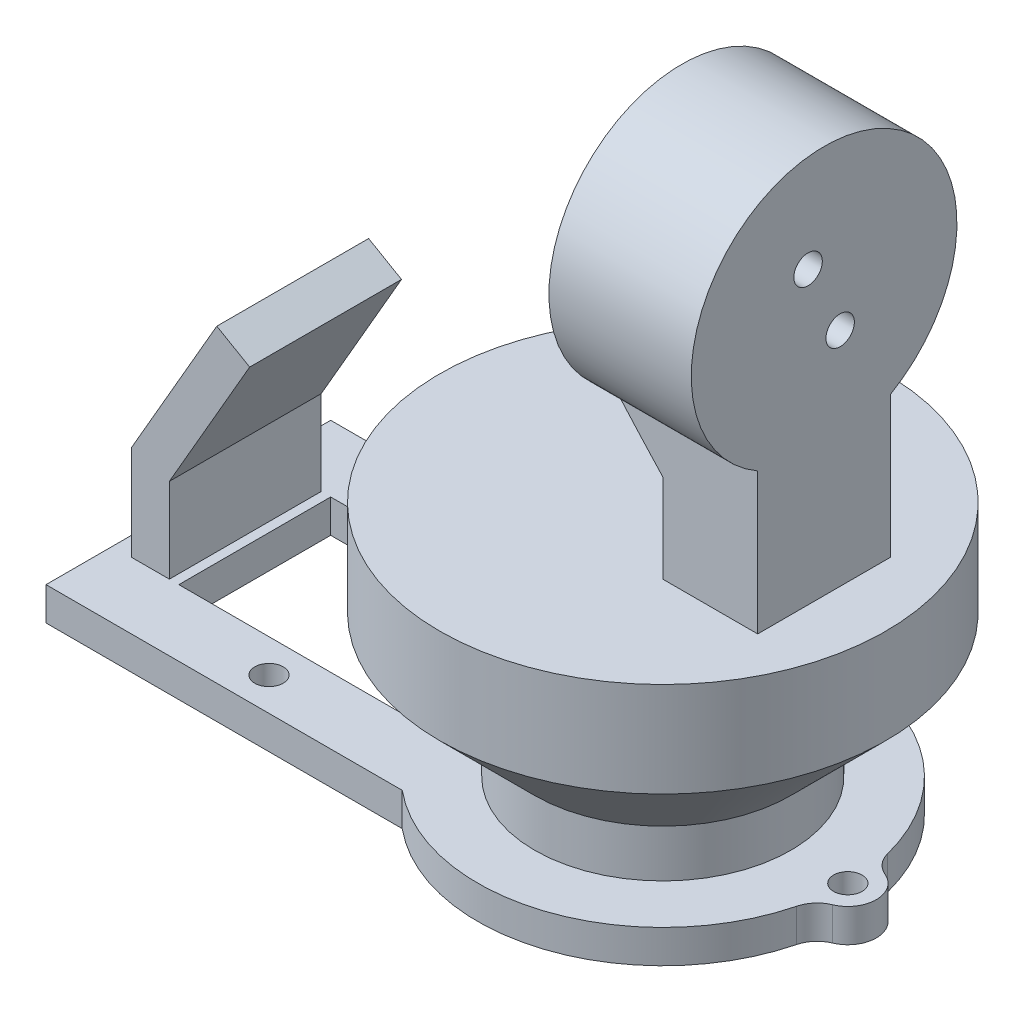
from build123d import *

# Parameters (mm, degrees)
SKETCH1_R           = 1.5
BOSS_EXTRUDE1_DEPTH = 3.5
BOSS_EXTRUDE2_DEPTH = 16
SKETCH4_R           = 13.5
BOSS_EXTRUDE3_DEPTH = 15
SKETCH5_R           = 23.5
BOSS_EXTRUDE4_DEPTH = 10
SKETCH6_W           = 10
SKETCH6_H           = 14
BOSS_EXTRUDE5_DEPTH = 20
SKETCH7_R           = 14
BOSS_EXTRUDE6_DEPTH = 15
CHAMFER1_SIZE       = 10
CUT_EXTRUDE4_REACH  = 91.925
SKETCH10_R          = 1.5
CHAMFER2_SIZE       = 5


with BuildPart() as part:
    # Sketch1 → Boss-Extrude1 (new body)
    with BuildSketch(Plane(origin=(0, 0, 0), x_dir=(1, 0, 0), z_dir=(0, 1, 0))):
        with BuildLine():
            Line((-50, -15), (-12.459935794, -15))
            ThreePointArc((-12.459935794, -15), (6.031468042, -18.543769661), (18.9, -4.8))
            ThreePointArc((18.9, -4.8), (19.537223284, -3.577601927), (20.653846154, -2.769230769))
            ThreePointArc((20.653846154, -2.769230769), (22.5, 0), (20.653846154, 2.769230769))
            ThreePointArc((20.653846154, 2.769230769), (19.537223284, 3.577601927), (18.9, 4.8))
            ThreePointArc((18.9, 4.8), (6.031468042, 18.543769661), (-12.459935794, 15))
            Line((-12.459935794, 15), (-50, 15))
            Line((-50, 15), (-50, -15))
        make_face()
        with Locations(Location((-30, -11.5, 0), (0, 0, 270))):
            Circle(SKETCH1_R, mode=Mode.SUBTRACT)
        with BuildLine():
            Line((-43, 8), (-17.783419244, 8))
            ThreePointArc((-17.783419244, 8), (-19.5, 0), (-17.783419244, -8))
            Line((-17.783419244, -8), (-43, -8))
            Line((-43, -8), (-43, 8))
        make_face(mode=Mode.SUBTRACT)
        with Locations(Location((-30, 11.5, 0), (0, 0, 270))):
            Circle(SKETCH1_R, mode=Mode.SUBTRACT)
        with Locations(Location((19.5, 0, 0), (0, 0, 270))):
            Circle(SKETCH1_R, mode=Mode.SUBTRACT)
    extrude(amount=BOSS_EXTRUDE1_DEPTH)

    # Sketch2 → Boss-Extrude2 (add)
    with BuildSketch(Plane.XY.offset(-8)):
        Polygon((-48, 3.5), (-48, 13.5), (-39, 29.088457268), (-35.535898385, 27.088457268), (-44, 12.42820323), (-44, 3.5), align=None)
    extrude(amount=BOSS_EXTRUDE2_DEPTH)

    # Sketch4 → Boss-Extrude3 (add)
    with BuildSketch(Plane(origin=(0, 3.5, 0), x_dir=(1, 0, 0), z_dir=(0, 1, 0))):
        with Locations(Location((0, 0, 0), (0, 0, 270))):
            Circle(SKETCH4_R)
    extrude(amount=BOSS_EXTRUDE3_DEPTH)

    # Sketch5 → Boss-Extrude4 (add)
    with BuildSketch(Plane(origin=(0, 18.5, 0), x_dir=(1, 0, 0), z_dir=(0, 1, 0))):
        with Locations(Location((0, 0, 0), (0, 0, 270))):
            Circle(SKETCH5_R)
    extrude(amount=BOSS_EXTRUDE4_DEPTH)

    # Sketch6 → Boss-Extrude5 (add)
    with BuildSketch(Plane(origin=(0, 28.5, 0), x_dir=(1, 0, 0), z_dir=(0, 1, 0))):
        with Locations((12, 0)):
            Rectangle(SKETCH6_W, SKETCH6_H)
    extrude(amount=BOSS_EXTRUDE5_DEPTH)

    # Sketch7 → Boss-Extrude6 (add)
    with BuildSketch(Plane(origin=(17, 0, 0), x_dir=(0, 0, -1), z_dir=(1, 0, 0))):
        with Locations((0, 55.5)):
            Circle(SKETCH7_R)
    extrude(amount=-BOSS_EXTRUDE6_DEPTH)

    # Chamfer1
    chamfer1_edges = [part.edges().sort_by_distance(p)[0] for p in [
        (0, 18.5, -13.5),
    ]]
    chamfer(chamfer1_edges, length=CHAMFER1_SIZE - 0.0001)  # a hair under: the kernel refuses the full size

    # Sketch10 → Cut-Extrude4 (cut, up to next)
    with BuildSketch(Plane.ZY.offset(-2), mode=Mode.PRIVATE) as cut_extrude4_sk1:
        with Locations((1.690473047, 59.125231148)):
            Circle(SKETCH10_R)
    cut_extrude4_tool1 = extrude(cut_extrude4_sk1.sketch, amount=-CUT_EXTRUDE4_REACH, mode=Mode.PRIVATE) & part.part
    # Sketch10 → Cut-Extrude4 (cut, up to next)
    with BuildSketch(Plane.ZY.offset(-2), mode=Mode.PRIVATE) as cut_extrude4_sk2:
        with Locations((-1.690473047, 51.874768852)):
            Circle(SKETCH10_R)
    cut_extrude4_tool2 = extrude(cut_extrude4_sk2.sketch, amount=-CUT_EXTRUDE4_REACH, mode=Mode.PRIVATE) & part.part
    add(cut_extrude4_tool1.solids().sort_by_distance((2, 59.125231, 1.690473))[0], mode=Mode.SUBTRACT)
    add(cut_extrude4_tool2.solids().sort_by_distance((2, 51.874769, -1.690473))[0], mode=Mode.SUBTRACT)

    # Chamfer2
    chamfer2_edges = [part.edges().sort_by_distance(p)[0] for p in [
        (7, 41.5, 0),
    ]]
    chamfer(chamfer2_edges, length=CHAMFER2_SIZE - 0.0001)  # a hair under: the kernel refuses the full size


solid = part.part
